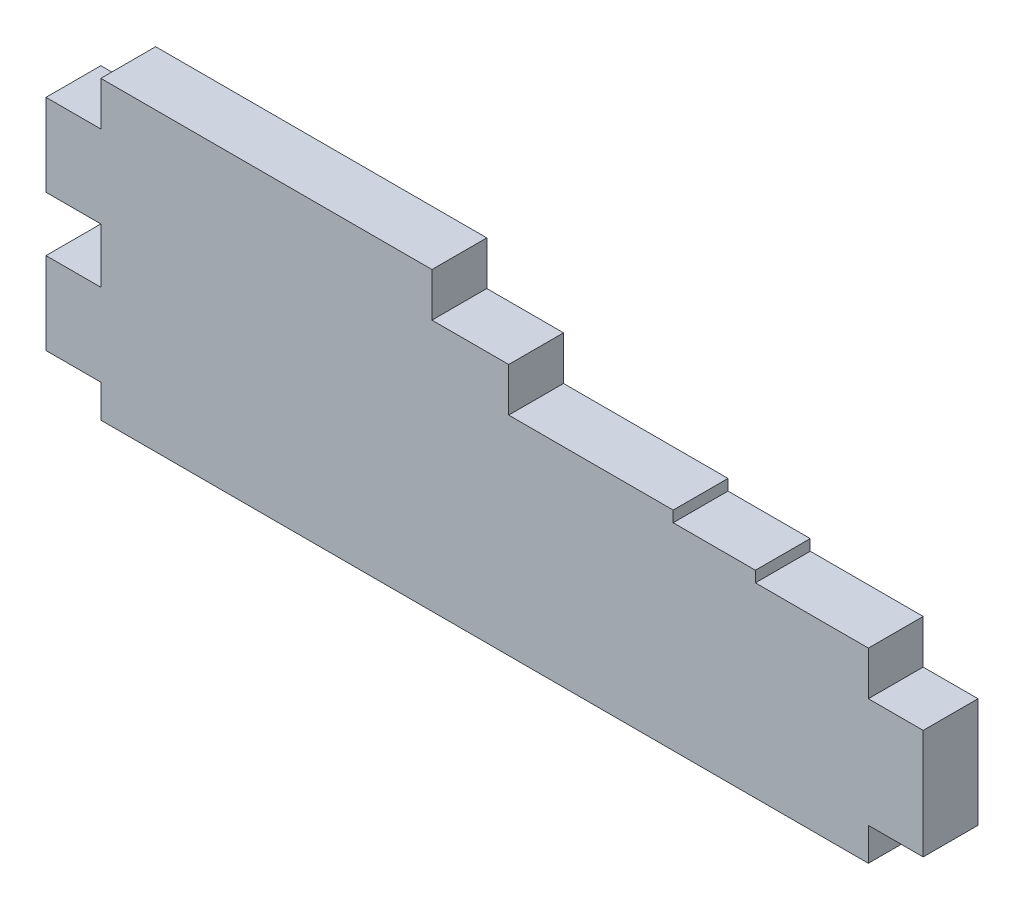
from build123d import *

# Parameters (mm, degrees)
BOSS_EXTRU_1_DEPTH = 5


with BuildPart() as part:
    # Esquisse1 → Boss.-Extru.1 (new body)
    with BuildSketch(Plane.XY):
        Polygon((-5, 0), (0, 0), (0, -3), (70, -3), (70, 0), (75, 0), (75, 10), (70, 10), (70, 14), (59.7, 14), (59.7, 15), (52.2, 15), (52.2, 16), (37.2, 16), (37.2, 20), (30.2, 20), (30.2, 24), (0, 24), (0, 20), (-5, 20), (-5, 12.5), (0, 12.5), (0, 7.5), (-5, 7.5), align=None)
    extrude(amount=BOSS_EXTRU_1_DEPTH)


solid = part.part
